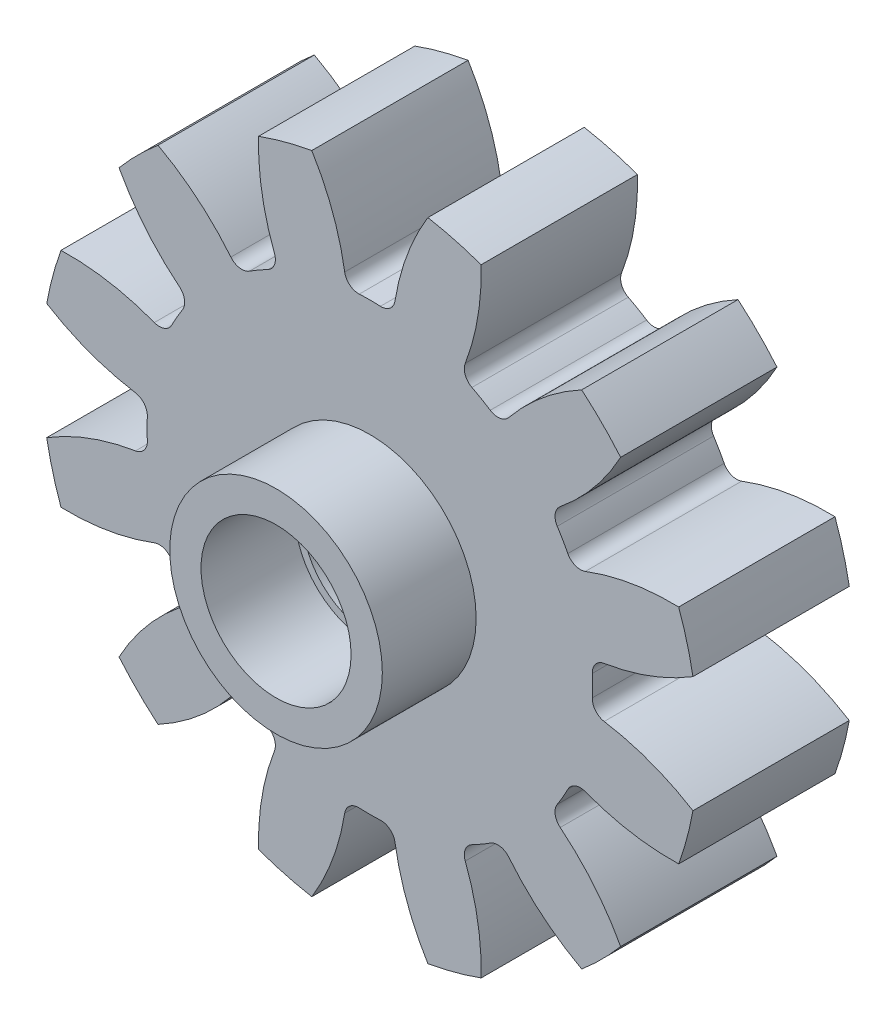
from build123d import *

# Parameters (mm, degrees)
SKETCH1_R                = 10.5
BOSS_EXTRUDE1_DEPTH      = 2.5
CUT_EXTRUDE1_DEPTH       = 16.058220346
FILLET1_R                = 0.45
CIRPATTERN1_COUNT        = 12
FILLET1_OF_CIRPATTERN1_R = 0.45
SKETCH3_R                = 3.4
SKETCH3_R_2              = 2.4
BOSS_EXTRUDE2_DEPTH      = 3
SKETCH8_R                = 2.161333762
CUT_EXTRUDE5_DEPTH       = 1


with BuildPart() as part:
    # Sketch1 → Boss-Extrude1 (new, symmetric)
    with BuildSketch(Plane.XY):
        Circle(SKETCH1_R)
    extrude(amount=BOSS_EXTRUDE1_DEPTH, both=True)

    # Sketch2 → Cut-Extrude1 (cut, symmetric)
    with BuildSketch(Plane.XY):
        with BuildLine():
            ThreePointArc((-2.49621045, 11.225815489), (-1.316774831, 9.284795282), (-0.749810724, 7.085436393))
            ThreePointArc((-0.749810724, 7.085436393), (0, 7.125), (0.749810724, 7.085436393))
            ThreePointArc((0.749810724, 7.085436393), (1.316774831, 9.284795282), (2.49621045, 11.225815489))
            ThreePointArc((2.49621045, 11.225815489), (0, 11.5), (-2.49621045, 11.225815489))
        make_face()
    cut_extrude1 = extrude(amount=CUT_EXTRUDE1_DEPTH, both=True, mode=Mode.SUBTRACT)

    # Fillet1
    fillet1_edges = [part.edges().sort_by_distance(p)[0] for p in [
        (0.749810724, 7.085436393, 0),
        (-0.749810724, 7.085436393, 0),
    ]]
    fillet(fillet1_edges, radius=FILLET1_R)

    # CirPattern1: Cut-Extrude1 ×12 about axis
    cirpattern1_axis = Axis((0, 0, 2.5), (0, 0, -1))
    for i in range(1, CIRPATTERN1_COUNT):
        add(cut_extrude1.rotate(cirpattern1_axis, i * 360 / CIRPATTERN1_COUNT), mode=Mode.SUBTRACT)

    # Fillet1 of CirPattern1
    fillet1_of_cirpattern1_edges = [part.edges().sort_by_distance(p)[0] for p in [
        (4.192073332, 5.761262551, 0),
        (2.893363061, 6.511073275, 0),
        (6.511073275, 2.893363061, 0),
        (5.761262551, 4.192073332, 0),
        (7.085436393, -0.749810724, 0),
        (7.085436393, 0.749810724, 0),
        (5.761262551, -4.192073332, 0),
        (6.511073275, -2.893363061, 0),
        (2.893363061, -6.511073275, 0),
        (4.192073332, -5.761262551, 0),
        (-0.749810724, -7.085436393, 0),
        (0.749810724, -7.085436393, 0),
        (-4.192073332, -5.761262551, 0),
        (-2.893363061, -6.511073275, 0),
        (-6.511073275, -2.893363061, 0),
        (-5.761262551, -4.192073332, 0),
        (-7.085436393, 0.749810724, 0),
        (-7.085436393, -0.749810724, 0),
        (-5.761262551, 4.192073332, 0),
        (-6.511073275, 2.893363061, 0),
        (-2.893363061, 6.511073275, 0),
        (-4.192073332, 5.761262551, 0),
    ]]
    fillet(fillet1_of_cirpattern1_edges, radius=FILLET1_OF_CIRPATTERN1_R)

    # Sketch3 → Boss-Extrude2 (add)
    with BuildSketch(Plane.XY.offset(2.5)):
        Circle(SKETCH3_R)
        Circle(SKETCH3_R_2, mode=Mode.SUBTRACT)
    extrude(amount=BOSS_EXTRUDE2_DEPTH)

    # Sketch8 → Cut-Extrude5 (cut)
    with BuildSketch(Plane.XY.offset(2.5)):
        with Locations((0.006065346, 0.009574222)):
            Circle(SKETCH8_R)
    extrude(amount=-CUT_EXTRUDE5_DEPTH, mode=Mode.SUBTRACT)


solid = part.part
